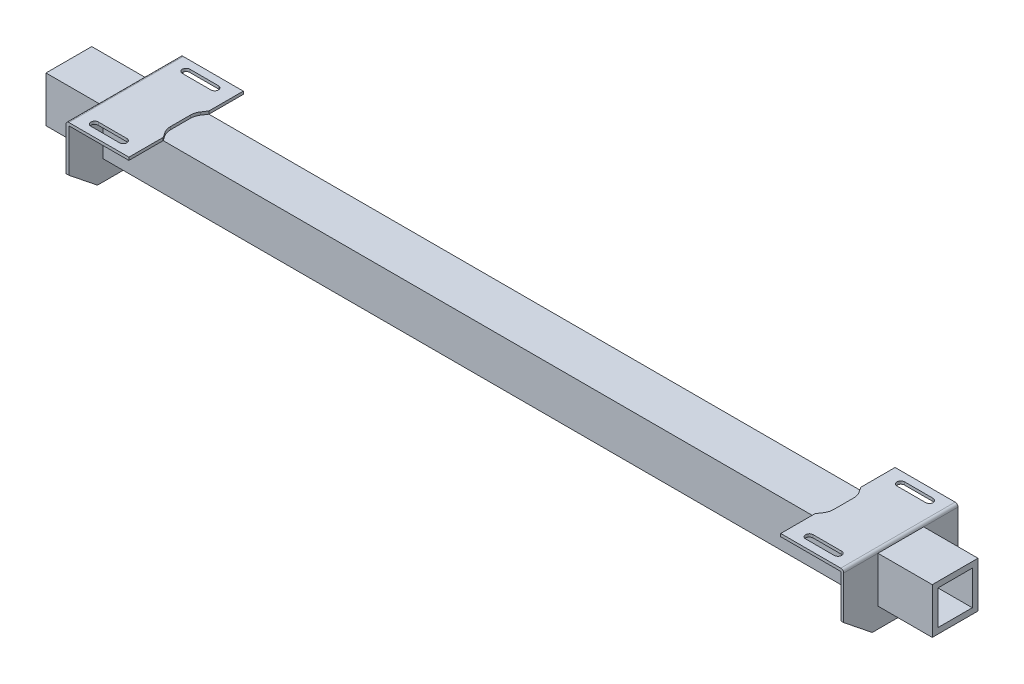
from build123d import *

# Parameters (mm, degrees)
SKETCH3_W                       = 80
SKETCH3_H                       = 80
SKETCH3_W_2                     = 60
SKETCH3_H_2                     = 60
BOSS_EXTRUDE2_DEPTH             = 1550
SKETCH7_W                       = 60
SKETCH7_H                       = 60
BOSS_EXTRUDE3_DEPTH             = 5
BOSS_EXTRUDE4_REACH             = 1560.629
SKETCH8_W                       = 110
SKETCH8_H                       = 5
BOSS_EXTRUDE4_DIRECTION_2_REACH = 1560.629
CUT_EXTRUDE1_DEPTH              = 5
CUT_EXTRUDE2_REACH              = 1562.929
FILLET1_R                       = 5
FILLET1_OF_MIRROR1_R            = 5
FILLET1_OF_MIRROR2_R            = 5


with BuildPart() as part:
    # Sketch3 → Boss-Extrude2 (new body)
    with BuildSketch(Plane(origin=(0, 0, 0), x_dir=(0, 0, -1), z_dir=(1, 0, 0))):
        with Locations((40, 40)):
            Rectangle(SKETCH3_W, SKETCH3_H)
        with Locations((40, 40)):
            Rectangle(SKETCH3_W_2, SKETCH3_H_2, mode=Mode.SUBTRACT)
    extrude(amount=BOSS_EXTRUDE2_DEPTH)

    # Sketch7 → Boss-Extrude3 (add)
    with BuildSketch(Plane(origin=(1450, 0, 0), x_dir=(0, 0, -1), z_dir=(1, 0, 0))):
        Polygon((-60, 85), (140, 85), (140, 5), (90, -35), (-10, -35), (-60, 5), align=None)
        with Locations((40, 40)):
            Rectangle(SKETCH7_W, SKETCH7_H, mode=Mode.SUBTRACT)
    boss_extrude3 = extrude(amount=BOSS_EXTRUDE3_DEPTH)

    # Boss-Extrude4: up to this face of the body (flat: up to its plane)
    boss_extrude4_end = Plane(part.part.faces().sort_by_distance((1452.5, 45, -140))[0])
    # Sketch8 → Boss-Extrude4 (add, up to the picked face)
    with BuildSketch(Plane(origin=(0, 0, -80), x_dir=(-1, 0, 0), z_dir=(0, 0, -1)), mode=Mode.PRIVATE) as boss_extrude4_sk1:
        with Locations((-1400, 82.5)):
            Rectangle(SKETCH8_W, SKETCH8_H)
    boss_extrude4_tool1 = split(extrude(boss_extrude4_sk1.sketch, amount=BOSS_EXTRUDE4_REACH, mode=Mode.PRIVATE), bisect_by=boss_extrude4_end, keep=Keep.BOTH, mode=Mode.PRIVATE)
    boss_extrude4 = boss_extrude4_tool1.solids().sort_by(Axis((1400, 82.5, -80), (0, 0, -1)))[0]
    add(boss_extrude4)

    # Boss-Extrude4 direction 2: up to this face of the body (flat: up to its plane)
    boss_extrude4_direction_2_end = Plane(part.part.faces().sort_by_distance((1452.5, 45, 60))[0])
    # Sketch8 → Boss-Extrude4 direction 2 (add, up to the picked face)
    with BuildSketch(Plane(origin=(0, 0, -80), x_dir=(-1, 0, 0), z_dir=(0, 0, -1)), mode=Mode.PRIVATE) as boss_extrude4_direction_2_sk1:
        with Locations((-1400, 82.5)):
            Rectangle(SKETCH8_W, SKETCH8_H)
    boss_extrude4_direction_2_tool1 = split(extrude(boss_extrude4_direction_2_sk1.sketch, amount=-BOSS_EXTRUDE4_DIRECTION_2_REACH, mode=Mode.PRIVATE), bisect_by=boss_extrude4_direction_2_end, keep=Keep.BOTH, mode=Mode.PRIVATE)
    boss_extrude4_direction_2 = boss_extrude4_direction_2_tool1.solids().sort_by(Axis((1400, 82.5, -80), (0, 0, 1)))[0]
    add(boss_extrude4_direction_2)

    # Sketch9 → Cut-Extrude1 (cut)
    with BuildSketch(Plane(origin=(0, 85, 0), x_dir=(1, 0, 0), z_dir=(0, 1, 0))):
        with BuildLine():
            Line((1345, 80), (1350.801257358, 71.298113962))
            ThreePointArc((1350.801257358, 71.298113962), (1353.927300662, 64.675212774), (1355, 57.430609057))
            Line((1355, 57.430609057), (1355, 22.569390943))
            ThreePointArc((1355, 22.569390943), (1353.927300662, 15.324787226), (1350.801257358, 8.701886038))
            Line((1350.801257358, 8.701886038), (1345, 0))
            Line((1345, 0), (1345, 80))
        make_face()
    cut_extrude1 = extrude(amount=-CUT_EXTRUDE1_DEPTH, mode=Mode.SUBTRACT)

    # Sketch10 → Cut-Extrude2 (cut, up to next)
    with BuildSketch(Plane(origin=(0, 85, 0), x_dir=(1, 0, 0), z_dir=(0, 1, 0)), mode=Mode.PRIVATE) as cut_extrude2_sk1:
        with BuildLine():
            Line((1375, 126.5), (1425, 126.5))
            ThreePointArc((1425, 126.5), (1431.5, 120), (1425, 113.5))
            Line((1425, 113.5), (1375, 113.5))
            ThreePointArc((1375, 113.5), (1368.5, 120), (1375, 126.5))
        make_face()
    cut_extrude2_tool1 = extrude(cut_extrude2_sk1.sketch, amount=-CUT_EXTRUDE2_REACH, mode=Mode.PRIVATE) & part.part
    # Sketch10 → Cut-Extrude2 (cut, up to next)
    with BuildSketch(Plane(origin=(0, 85, 0), x_dir=(1, 0, 0), z_dir=(0, 1, 0)), mode=Mode.PRIVATE) as cut_extrude2_sk2:
        with BuildLine():
            Line((1375, -33.5), (1425, -33.5))
            ThreePointArc((1425, -33.5), (1431.5, -40), (1425, -46.5))
            Line((1425, -46.5), (1375, -46.5))
            ThreePointArc((1375, -46.5), (1368.5, -40), (1375, -33.5))
        make_face()
    cut_extrude2_tool2 = extrude(cut_extrude2_sk2.sketch, amount=-CUT_EXTRUDE2_REACH, mode=Mode.PRIVATE) & part.part
    cut_extrude2_1 = cut_extrude2_tool1.solids().sort_by_distance((1400, 85, -120))[0]
    add(cut_extrude2_1, mode=Mode.SUBTRACT)
    cut_extrude2_2 = cut_extrude2_tool2.solids().sort_by_distance((1400, 85, 40))[0]
    add(cut_extrude2_2, mode=Mode.SUBTRACT)
    cut_extrude2 = cut_extrude2_1 + cut_extrude2_2  # Cut-Extrude2 as one shape, for the pattern or mirror that repeats it

    # Fillet1
    fillet1_edges = [part.edges().sort_by_distance(p)[0] for p in [
        (1455, 85, -40),
    ]]
    fillet(fillet1_edges, radius=FILLET1_R - 0.0001)  # a hair under: the kernel refuses the full size

    # Mirror1: Boss-Extrude3 across plane
    add(boss_extrude3.mirror(Plane(origin=(775, 0, 0), x_dir=(0, 0, 1), z_dir=(1, 0, 0))))

    # Fillet1 of Mirror1
    fillet1_of_mirror1_edges = [part.edges().sort_by_distance(p)[0] for p in [
        (95, 85, -40),
    ]]
    fillet(fillet1_of_mirror1_edges, radius=FILLET1_OF_MIRROR1_R - 0.0001)  # a hair under: the kernel refuses the full size

    # Mirror2: Boss-Extrude3, Boss-Extrude4, Boss-Extrude4 direction 2, Cut-Extrude1, Cut-Extrude2 across plane
    add(boss_extrude3.mirror(Plane(origin=(775, 0, 0), x_dir=(0, 0, 1), z_dir=(1, 0, 0))))
    add(boss_extrude4.mirror(Plane(origin=(775, 0, 0), x_dir=(0, 0, 1), z_dir=(1, 0, 0))))
    add(boss_extrude4_direction_2.mirror(Plane(origin=(775, 0, 0), x_dir=(0, 0, 1), z_dir=(1, 0, 0))))
    add(cut_extrude1.mirror(Plane(origin=(775, 0, 0), x_dir=(0, 0, 1), z_dir=(1, 0, 0))), mode=Mode.SUBTRACT)
    add(cut_extrude2.mirror(Plane(origin=(775, 0, 0), x_dir=(0, 0, 1), z_dir=(1, 0, 0))), mode=Mode.SUBTRACT)

    # Fillet1 of Mirror2
    fillet1_of_mirror2_edges = [part.edges().sort_by_distance(p)[0] for p in [
        (95, 85, -40),
    ]]
    fillet(fillet1_of_mirror2_edges, radius=FILLET1_OF_MIRROR2_R - 0.0001)  # a hair under: the kernel refuses the full size


solid = part.part
